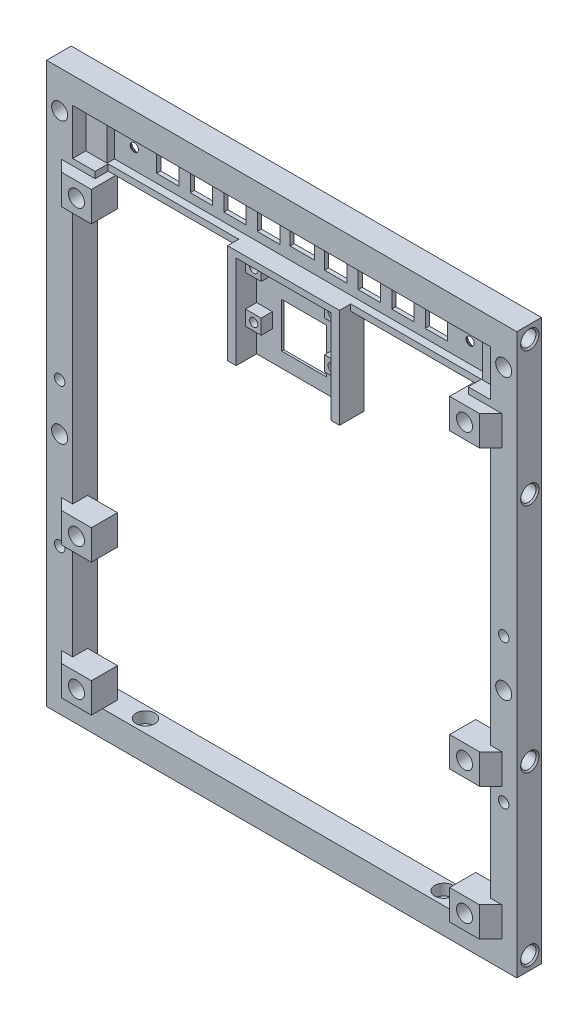
from build123d import *
from build123d.topology import SkipClean

# Parameters (mm, degrees)
SKETCH1_W                = 126
SKETCH1_H                = 150
SKETCH1_W_2              = 112
SKETCH1_H_2              = 136
BOSS_EXTRUDE1_DEPTH      = 7
SKETCH2_R                = 2.05
CUT_EXTRUDE1_DEPTH       = 6
SKETCH3_R                = 1.35
CUT_EXTRUDE2_DEPTH       = 157.419308271
SKETCH4_R                = 2.5
CUT_EXTRUDE3_DEPTH       = 3
SKETCH5_R                = 1.4
CUT_EXTRUDE4_DEPTH       = 99.198777996
SKETCH6_R                = 2.5
CUT_EXTRUDE5_DEPTH       = 3
SKETCH7_R                = 2.15
CUT_EXTRUDE6_DEPTH       = 99.198777996
CUT_EXTRUDE7_DEPTH       = 0.2
SKETCH9_W                = 2.8
SKETCH9_H                = 2.8
CUT_EXTRUDE8_DEPTH       = 0.2
SKETCH10_W               = 6
SKETCH10_H               = 6
BOSS_EXTRUDE2_DEPTH      = 5.5
SKETCH11_R               = 1.65
CUT_EXTRUDE9_DEPTH       = 99.103261923
SKETCH12_W               = 112
SKETCH12_H               = 14
BOSS_EXTRUDE3_DEPTH      = 1.5
SKETCH13_W               = 112
SKETCH13_H               = 14
SKETCH13_W_2             = 100.6
SKETCH13_H_2             = 10.6
BOSS_EXTRUDE4_DEPTH      = 2
SKETCH14_W               = 6
SKETCH14_H               = 6
SKETCH14_W_2             = 6.5
SKETCH14_H_2             = 4
CUT_EXTRUDE10_DEPTH      = 99.103261923
SKETCH15_R               = 1
BOSS_EXTRUDE5_DEPTH      = 2
CHAMFER2_SIZE            = 0.4
CHAMFER3_SIZE            = 0.4
SKETCH16_W               = 6
SKETCH16_H               = 6
BOSS_EXTRUDE7_DEPTH      = 5.5
SKETCH17_R               = 1.65
CUT_EXTRUDE11_DEPTH      = 99.103261923
CUT_EXTRUDE12_DEPTH      = 99.103261923
CUT_EXTRUDE12_DEPTH_BACK = 99.103261923
SKETCH18_R               = 1.1
CHAMFER4_SIZE            = 1.3
SKETCH19_W               = 112
SKETCH19_H               = 122
CUT_EXTRUDE13_DEPTH      = 99.103261923
SKETCH20_W               = 8
SKETCH20_H               = 8
BOSS_EXTRUDE8_DEPTH      = 7
SKETCH21_R               = 2.15
CUT_EXTRUDE14_DEPTH      = 99.198777996
CHAMFER5_SIZE            = 3
SKETCH23_W               = 30
SKETCH23_H               = 25
BOSS_EXTRUDE10_DEPTH     = 3.5
SKETCH24_W               = 25.4
SKETCH24_H               = 25
CUT_EXTRUDE15_DEPTH      = 2.5
SKETCH27_W               = 4.2
SKETCH27_H               = 4.6
SKETCH27_H_2             = 4
BOSS_EXTRUDE11_DEPTH     = 3
SKETCH28_W               = 12
SKETCH28_H               = 12
CUT_EXTRUDE16_DEPTH      = 99.361577865
SKETCH29_R               = 1.1
CUT_EXTRUDE17_DEPTH      = 99.132563403
CHAMFER6_SIZE            = 1.3
CHAMFER7_SIZE            = 0.4
CHAMFER8_SIZE            = 0.4
BOSS_EXTRUDE12_DEPTH     = 3
CHAMFER9_SIZE            = 0.4


with BuildPart() as part:
    # Sketch1 → Boss-Extrude1 (new body)
    with BuildSketch(Plane.XY):
        Rectangle(SKETCH1_W, SKETCH1_H)
        Rectangle(SKETCH1_W_2, SKETCH1_H_2, mode=Mode.SUBTRACT)
    extrude(amount=BOSS_EXTRUDE1_DEPTH)

    # Sketch2 → Cut-Extrude1 (cut)
    with BuildSketch(Plane.ZY.offset(63)):
        with Locations((3.5, -71.5)):
            Circle(SKETCH2_R)
        with Locations((3.5, 71.5)):
            Circle(SKETCH2_R)
        with Locations((3.5, 35.5)):
            Circle(SKETCH2_R)
        with Locations((3.5, -26.5)):
            Circle(SKETCH2_R)
    cut_extrude1 = extrude(amount=-CUT_EXTRUDE1_DEPTH, mode=Mode.SUBTRACT)

    # Mirror1: Cut-Extrude1 across plane
    add(cut_extrude1.mirror(Plane(origin=(0, 0, 0), x_dir=(0, 0, 1), z_dir=(1, 0, 0))), mode=Mode.SUBTRACT)

    # Sketch3 → Cut-Extrude2 (cut, through all)
    with BuildSketch(Plane(origin=(0, -68, 0), x_dir=(1, 0, 0), z_dir=(0, 1, 0))):
        with Locations(Location((40, -3.5, 0), (0, 0, 270))):
            Circle(SKETCH3_R)
        with Locations(Location((-40, -3.5, 0), (0, 0, 270))):
            Circle(SKETCH3_R)
    extrude(amount=-CUT_EXTRUDE2_DEPTH, mode=Mode.SUBTRACT)

    # Sketch4 → Cut-Extrude3 (cut)
    with BuildSketch(Plane(origin=(0, -68, 0), x_dir=(1, 0, 0), z_dir=(0, 1, 0))):
        with Locations(Location((40, -3.5, 0), (0, 0, 270))):
            Circle(SKETCH4_R)
        with Locations(Location((-40, -3.5, 0), (0, 0, 270))):
            Circle(SKETCH4_R)
    extrude(amount=-CUT_EXTRUDE3_DEPTH, mode=Mode.SUBTRACT)

    # Sketch5 → Cut-Extrude4 (cut, through all)
    with BuildSketch(Plane(origin=(0, 0, 0), x_dir=(-1, 0, 0), z_dir=(0, 0, -1))):
        with Locations((-59.5, 2.6)):
            Circle(SKETCH5_R)
        with Locations(Location((59.5, 2.6, 0), (0, 0, 180))):
            Circle(SKETCH5_R)
        with Locations((-59.5, -36)):
            Circle(SKETCH5_R)
        with Locations(Location((59.5, -36, 0), (0, 0, 180))):
            Circle(SKETCH5_R)
    extrude(amount=-CUT_EXTRUDE4_DEPTH, mode=Mode.SUBTRACT)

    # Sketch6 → Cut-Extrude5 (cut)
    with BuildSketch(Plane(origin=(0, 0, 0), x_dir=(-1, 0, 0), z_dir=(0, 0, -1))):
        with Locations((-59.5, 2.6)):
            Circle(SKETCH6_R)
        with Locations((59.5, 2.6)):
            Circle(SKETCH6_R)
        with Locations((-59.5, -36)):
            Circle(SKETCH6_R)
        with Locations((59.5, -36)):
            Circle(SKETCH6_R)
    extrude(amount=-CUT_EXTRUDE5_DEPTH, mode=Mode.SUBTRACT)

    # Sketch7 → Cut-Extrude6 (cut, through all)
    with BuildSketch(Plane(origin=(0, 0, 0), x_dir=(-1, 0, 0), z_dir=(0, 0, -1))):
        with Locations((-59.5, 65)):
            Circle(SKETCH7_R)
        with Locations((-59.5, -10)):
            Circle(SKETCH7_R)
    cut_extrude6 = extrude(amount=-CUT_EXTRUDE6_DEPTH, mode=Mode.SUBTRACT)

    # Mirror2: Cut-Extrude6 across plane
    add(cut_extrude6.mirror(Plane(origin=(0, 0, 0), x_dir=(0, 0, 1), z_dir=(1, 0, 0))), mode=Mode.SUBTRACT)

    # Sketch8 → Cut-Extrude7 (cut)
    with SkipClean():  # the faces are left unmerged after this step: merging them gives an invalid solid
        with BuildSketch(Plane(origin=(0, 0, 3), x_dir=(-1, 0, 0), z_dir=(0, 0, -1))):
            with BuildLine():
                Line((-60.9, 0.528768482), (-60.9, 4.671231518))
                ThreePointArc((-60.9, 4.671231518), (-59.5, 5.1), (-58.1, 4.671231518))
                Line((-58.1, 4.671231518), (-58.1, 0.528768482))
                ThreePointArc((-58.1, 0.528768482), (-59.5, 0.1), (-60.9, 0.528768482))
            make_face()
            with BuildLine():
                Line((-60.9, -38.071231518), (-60.9, -33.928768482))
                ThreePointArc((-60.9, -33.928768482), (-59.5, -33.5), (-58.1, -33.928768482))
                Line((-58.1, -33.928768482), (-58.1, -38.071231518))
                ThreePointArc((-58.1, -38.071231518), (-59.5, -38.5), (-60.9, -38.071231518))
            make_face()
        cut_extrude7 = extrude(amount=-CUT_EXTRUDE7_DEPTH, mode=Mode.SUBTRACT)

    # Sketch9 → Cut-Extrude8 (cut)
    with SkipClean():  # the faces are left unmerged after this step: merging them gives an invalid solid
        with BuildSketch(Plane(origin=(0, 0, 3.2), x_dir=(-1, 0, 0), z_dir=(0, 0, -1))):
            with Locations((-59.5, 2.6)):
                Rectangle(SKETCH9_W, SKETCH9_H)
            with Locations((-59.5, -36)):
                Rectangle(SKETCH9_W, SKETCH9_H)
        cut_extrude8 = extrude(amount=-CUT_EXTRUDE8_DEPTH, mode=Mode.SUBTRACT)

    # Mirror3: Cut-Extrude7, Cut-Extrude8 across plane
    with SkipClean():  # the faces are left unmerged after this step: merging them gives an invalid solid
        add(cut_extrude7.mirror(Plane(origin=(0, 0, 0), x_dir=(0, 0, 1), z_dir=(1, 0, 0))), mode=Mode.SUBTRACT)
        add(cut_extrude8.mirror(Plane(origin=(0, 0, 0), x_dir=(0, 0, 1), z_dir=(1, 0, 0))), mode=Mode.SUBTRACT)

    # Sketch10 → Boss-Extrude2 (add)
    with SkipClean():  # the faces are left unmerged after this step: merging them gives an invalid solid
        with BuildSketch(Plane.XY.offset(7)):
            with Locations((53, -65)):
                Rectangle(SKETCH10_W, SKETCH10_H)
            with Locations((53, -35.5)):
                Rectangle(SKETCH10_W, SKETCH10_H)
        boss_extrude2 = extrude(amount=-BOSS_EXTRUDE2_DEPTH)

    # Sketch11 → Cut-Extrude9 (cut, through all)
    with SkipClean():  # the faces are left unmerged after this step: merging them gives an invalid solid
        with BuildSketch(Plane(origin=(0, 0, 1.5), x_dir=(-1, 0, 0), z_dir=(0, 0, -1))):
            with Locations((-53, -35.5)):
                Circle(SKETCH11_R)
            with Locations((-53, -65)):
                Circle(SKETCH11_R)
        cut_extrude9 = extrude(amount=-CUT_EXTRUDE9_DEPTH, mode=Mode.SUBTRACT)

    # Mirror4: Boss-Extrude2, Cut-Extrude9 across plane
    with SkipClean():  # the faces are left unmerged after this step: merging them gives an invalid solid
        add(boss_extrude2.mirror(Plane(origin=(0, 0, 0), x_dir=(0, 0, 1), z_dir=(1, 0, 0))))
        add(cut_extrude9.mirror(Plane(origin=(0, 0, 0), x_dir=(0, 0, 1), z_dir=(1, 0, 0))), mode=Mode.SUBTRACT)

    # Sketch12 → Boss-Extrude3 (add)
    with SkipClean():  # the faces are left unmerged after this step: merging them gives an invalid solid
        with BuildSketch(Plane(origin=(0, 0, 0), x_dir=(-1, 0, 0), z_dir=(0, 0, -1))):
            with Locations((0, 61)):
                Rectangle(SKETCH12_W, SKETCH12_H)
        extrude(amount=-BOSS_EXTRUDE3_DEPTH)

    # Sketch13 → Boss-Extrude4 (add)
    with SkipClean():  # the faces are left unmerged after this step: merging them gives an invalid solid
        with BuildSketch(Plane.XY.offset(1.5)):
            with Locations((0, 61)):
                Rectangle(SKETCH13_W, SKETCH13_H)
            with Locations((0, 61)):
                Rectangle(SKETCH13_W_2, SKETCH13_H_2, mode=Mode.SUBTRACT)
        extrude(amount=BOSS_EXTRUDE4_DEPTH)

    # Sketch14 → Cut-Extrude10 (cut, through all)
    with SkipClean():  # the faces are left unmerged after this step: merging them gives an invalid solid
        with BuildSketch(Plane.XY.offset(1.5)):
            with Locations((-36, 61)):
                Rectangle(SKETCH14_W, SKETCH14_H)
            with Locations((0, 61)):
                Rectangle(SKETCH14_W_2, SKETCH14_H_2)
            with Locations((9, 61)):
                Rectangle(SKETCH14_W, SKETCH14_H)
            with Locations((18, 61)):
                Rectangle(SKETCH14_W, SKETCH14_H)
            with Locations((27, 61)):
                Rectangle(SKETCH14_W, SKETCH14_H)
            with Locations((36, 61)):
                Rectangle(SKETCH14_W, SKETCH14_H)
            with Locations((-27, 61)):
                Rectangle(SKETCH14_W, SKETCH14_H)
            with Locations((-18, 61)):
                Rectangle(SKETCH14_W, SKETCH14_H)
            with Locations((-9, 61)):
                Rectangle(SKETCH14_W, SKETCH14_H)
        extrude(amount=-CUT_EXTRUDE10_DEPTH, mode=Mode.SUBTRACT)

    # Sketch15 → Boss-Extrude5 (add)
    with SkipClean():  # the faces are left unmerged after this step: merging them gives an invalid solid
        with BuildSketch(Plane.XY.offset(1.5)):
            with Locations(Location((-45, 61, 0), (0, 0, 180))):
                Circle(SKETCH15_R)
            with Locations(Location((45, 61, 0), (0, 0, 180))):
                Circle(SKETCH15_R)
        extrude(amount=BOSS_EXTRUDE5_DEPTH)

    # Chamfer1: read off the stored shape, not the designer's step
    # Chamfer1: loft between two sections, ruled curve by curve
    with SkipClean():  # the faces are left unmerged after this step: merging them gives an invalid solid
        chamfer1_from = [
            Edge.make_line((-56, 54, 0.4), (-56, -68, 0.4)),
            Edge.make_line((-56, -68, 0.4), (56, -68, 0.4)),
            Edge.make_line((56, -68, 0.4), (56, 54, 0.4)),
            Edge.make_line((56, 54, 0.4), (-56, 54, 0.4)),
        ]
        chamfer1_to = [
            Edge.make_line((-56.4, 54, 0), (-56.4, -68.4, 0)),
            Edge.make_line((-56.4, -68.4, 0), (56.4, -68.4, 0)),
            Edge.make_line((56.4, -68.4, 0), (56.4, 54, 0)),
            Edge.make_line((56.4, 54, 0), (-56.4, 54, 0)),
        ]
        chamfer1 = Solid(Shell([*[Face.make_surface_from_curves(chamfer1_from[k], chamfer1_to[k]) for k in range(4)], Face(Wire(chamfer1_from)), Face(Wire(chamfer1_to))]))
        add(chamfer1, mode=Mode.SUBTRACT)

    # Chamfer2
    chamfer2_edges = [part.edges().sort_by_distance(p)[0] for p in [
        (0, -75, 0),
        (-63, 0, 0),
        (0, 75, 0),
        (63, 0, 0),
    ]]
    chamfer(chamfer2_edges, length=CHAMFER2_SIZE)

    # Chamfer3
    chamfer3_edges = [part.edges().sort_by_distance(p)[0] for p in [
        (-6, 61, 0),
        (-9, 58, 0),
        (-12, 61, 0),
        (-9, 64, 0),
        (-15, 61, 0),
        (-18, 58, 0),
        (-21, 61, 0),
        (-18, 64, 0),
        (-24, 61, 0),
        (-27, 58, 0),
        (-30, 61, 0),
        (-27, 64, 0),
        (-33, 61, 0),
        (-36, 58, 0),
        (-39, 61, 0),
        (-36, 64, 0),
        (39, 61, 0),
        (36, 58, 0),
        (33, 61, 0),
        (36, 64, 0),
        (30, 61, 0),
        (27, 58, 0),
        (24, 61, 0),
        (27, 64, 0),
        (21, 61, 0),
        (18, 58, 0),
        (15, 61, 0),
        (18, 64, 0),
        (12, 61, 0),
        (9, 58, 0),
        (6, 61, 0),
        (9, 64, 0),
        (3.25, 61, 0),
        (0, 59, 0),
        (-3.25, 61, 0),
        (0, 63, 0),
    ]]
    chamfer(chamfer3_edges, length=CHAMFER3_SIZE)

    # Sketch16 → Boss-Extrude7 (add)
    with SkipClean():  # the faces are left unmerged after this step: merging them gives an invalid solid
        with BuildSketch(Plane.XY.offset(7)):
            Polygon((-50, 54), (-50, 55.7), (-56, 55.7), (-56, 54), (-56, 48), (-50, 48), align=None)
            with Locations((-53, -29.5)):
                Rectangle(SKETCH16_W, SKETCH16_H)
            with Locations((53, -29.5)):
                Rectangle(SKETCH16_W, SKETCH16_H)
            Polygon((56, 54), (56, 48), (50, 48), (50, 54), (50, 55.7), (56, 55.7), align=None)
        extrude(amount=-BOSS_EXTRUDE7_DEPTH)

    # Sketch17 → Cut-Extrude11 (cut, through all)
    with SkipClean():  # the faces are left unmerged after this step: merging them gives an invalid solid
        with BuildSketch(Plane(origin=(0, 0, 1.5), x_dir=(-1, 0, 0), z_dir=(0, 0, -1))):
            with Locations((-53, -29.5)):
                Circle(SKETCH17_R)
            with Locations((53, -29.5)):
                Circle(SKETCH17_R)
            with Locations((53, 51)):
                Circle(SKETCH17_R)
            with Locations((-53, 51)):
                Circle(SKETCH17_R)
        extrude(amount=-CUT_EXTRUDE11_DEPTH, mode=Mode.SUBTRACT)

    # Sketch18 → Cut-Extrude12 (cut, two sides: drawn at the far end of the back side and taken through both)
    with SkipClean():  # the faces are left unmerged after this step: merging them gives an invalid solid
        with BuildSketch(Plane.XY.offset(1.5).offset(-CUT_EXTRUDE12_DEPTH_BACK)):
            with Locations((-45, 61)):
                Circle(SKETCH18_R)
            with Locations((45, 61)):
                Circle(SKETCH18_R)
        extrude(amount=CUT_EXTRUDE12_DEPTH + CUT_EXTRUDE12_DEPTH_BACK, mode=Mode.SUBTRACT)

    # Chamfer4
    chamfer4_edges = [part.edges().sort_by_distance(p)[0] for p in [
        (-46.1, 61, 0),
        (43.9, 61, 0),
    ]]
    chamfer(chamfer4_edges, length=CHAMFER4_SIZE)

    # Sketch19 → Cut-Extrude13 (cut, through all)
    with SkipClean():  # the faces are left unmerged after this step: merging them gives an invalid solid
        with BuildSketch(Plane(origin=(0, 0, 1.5), x_dir=(-1, 0, 0), z_dir=(0, 0, -1))):
            with Locations((0, -7)):
                Rectangle(SKETCH19_W, SKETCH19_H)
        extrude(amount=-CUT_EXTRUDE13_DEPTH, mode=Mode.SUBTRACT)

    # Sketch20 → Boss-Extrude8 (add)
    with SkipClean():  # the faces are left unmerged after this step: merging them gives an invalid solid
        with BuildSketch(Plane.XY.offset(3)):
            with Locations((52, -64)):
                Rectangle(SKETCH20_W, SKETCH20_H)
            with Locations((52, 50)):
                Rectangle(SKETCH20_W, SKETCH20_H)
            with Locations((52, -28.5)):
                Rectangle(SKETCH20_W, SKETCH20_H)
        boss_extrude8 = extrude(amount=BOSS_EXTRUDE8_DEPTH)

    # Sketch21 → Cut-Extrude14 (cut, through all)
    with SkipClean():  # the faces are left unmerged after this step: merging them gives an invalid solid
        with BuildSketch(Plane(origin=(0, 0, 3), x_dir=(-1, 0, 0), z_dir=(0, 0, -1))):
            with Locations((-52, 50)):
                Circle(SKETCH21_R)
            with Locations((-52, -64)):
                Circle(SKETCH21_R)
            with Locations((-52, -28.5)):
                Circle(SKETCH21_R)
        cut_extrude14 = extrude(amount=-CUT_EXTRUDE14_DEPTH, mode=Mode.SUBTRACT)

    # Mirror5: Boss-Extrude8, Cut-Extrude14 across plane
    with SkipClean():  # the faces are left unmerged after this step: merging them gives an invalid solid
        add(boss_extrude8.mirror(Plane(origin=(0, 0, 0), x_dir=(0, 0, 1), z_dir=(1, 0, 0))))
        add(cut_extrude14.mirror(Plane(origin=(0, 0, 0), x_dir=(0, 0, 1), z_dir=(1, 0, 0))), mode=Mode.SUBTRACT)

    # Chamfer5
    # the kernel refuses this chamfer: 3 mm, written as the material it adds along each edge
    with BuildSketch(Plane(origin=(-56, -62, 7), x_dir=(-1, 0, 0), z_dir=(0, -1, 0)), Plane(origin=(56, -68, 7), x_dir=(1, 0, 0), z_dir=(0, 1, 0)), Plane(origin=(-56, -26.5, 7), x_dir=(-1, 0, 0), z_dir=(0, -1, 0)), Plane(origin=(56, -32.5, 7), x_dir=(1, 0, 0), z_dir=(0, 1, 0))) as chamfer5_piece_1:
        Polygon((CHAMFER5_SIZE, 0), (0, -CHAMFER5_SIZE), (0, 0), align=None)
    extrude(amount=6)
    with BuildSketch(Plane(origin=(56, 54, 7), x_dir=(1, 0, 0), z_dir=(0, -1, 0)), Plane(origin=(-56, 48, 7), x_dir=(-1, 0, 0), z_dir=(0, 1, 0))) as chamfer5_piece_2:
        Polygon((CHAMFER5_SIZE, 0), (0, CHAMFER5_SIZE), (0, 0), align=None)
    extrude(amount=6)
    with BuildSketch(Plane(origin=(56, -26.5, 7), x_dir=(1, 0, 0), z_dir=(0, 1, 0)), Plane(origin=(-56, -24.5, 7), x_dir=(-1, 0, 0), z_dir=(0, -1, 0)), Plane(origin=(-56, 48, 7), x_dir=(-1, 0, 0), z_dir=(0, -1, 0)), Plane(origin=(56, 46, 7), x_dir=(1, 0, 0), z_dir=(0, 1, 0)), Plane(origin=(56, -62, 7), x_dir=(1, 0, 0), z_dir=(0, 1, 0)), Plane(origin=(-56, -60, 7), x_dir=(-1, 0, 0), z_dir=(0, -1, 0))) as chamfer5_piece_3:
        Polygon((CHAMFER5_SIZE, 0), (0, -CHAMFER5_SIZE), (0, 0), align=None)
    extrude(amount=2)

    # Sketch23 → Boss-Extrude10 (add)
    with BuildSketch(Plane(origin=(0, 0, 0), x_dir=(-1, 0, 0), z_dir=(0, 0, -1))):
        with Locations((0, 41.5)):
            Rectangle(SKETCH23_W, SKETCH23_H)
    extrude(amount=-BOSS_EXTRUDE10_DEPTH)

    # Sketch24 → Cut-Extrude15 (cut)
    with BuildSketch(Plane.XY.offset(3.5)):
        with Locations((0, 41.5)):
            Rectangle(SKETCH24_W, SKETCH24_H)
    extrude(amount=-CUT_EXTRUDE15_DEPTH, mode=Mode.SUBTRACT)

    # Sketch27 → Boss-Extrude11 (add)
    with BuildSketch(Plane.XY.offset(1)):
        with Locations((-10.6, 51.7)):
            Rectangle(SKETCH27_W, SKETCH27_H)
        with Locations((-10.6, 38.9)):
            Rectangle(SKETCH27_W, SKETCH27_H_2)
        with Locations((10.6, 38.9)):
            Rectangle(SKETCH27_W, SKETCH27_H_2)
        with Locations((10.6, 51.7)):
            Rectangle(SKETCH27_W, SKETCH27_H)
    extrude(amount=BOSS_EXTRUDE11_DEPTH)

    # Sketch28 → Cut-Extrude16 (cut, through all)
    with BuildSketch(Plane.XY.offset(1)):
        with Locations((0, 39)):
            Rectangle(SKETCH28_W, SKETCH28_H)
    extrude(amount=-CUT_EXTRUDE16_DEPTH, mode=Mode.SUBTRACT)

    # Sketch29 → Cut-Extrude17 (cut, through all)
    with BuildSketch(Plane.XY.offset(4)):
        with Locations((-10.5, 38.9)):
            Circle(SKETCH29_R)
        with Locations((-10.5, 51.4)):
            Circle(SKETCH29_R)
        with Locations((10.5, 51.4)):
            Circle(SKETCH29_R)
        with Locations((10.5, 38.9)):
            Circle(SKETCH29_R)
    extrude(amount=-CUT_EXTRUDE17_DEPTH, mode=Mode.SUBTRACT)

    # Chamfer6
    chamfer6_edges = [part.edges().sort_by_distance(p)[0] for p in [
        (9.4, 38.9, 0),
        (9.4, 51.4, 0),
        (-11.6, 51.4, 0),
        (-11.6, 38.9, 0),
    ]]
    chamfer(chamfer6_edges, length=CHAMFER6_SIZE)

    # Chamfer7
    chamfer7_edges = [part.edges().sort_by_distance(p)[0] for p in [
        (6, 39, 0),
        (0, 33, 0),
        (-6, 39, 0),
        (0, 45, 0),
    ]]
    chamfer(chamfer7_edges, length=CHAMFER7_SIZE)

    # Chamfer8
    chamfer8_edges = [part.edges().sort_by_distance(p)[0] for p in [
        (-35.7, 54, 0),
        (35.7, 54, 0),
    ]]
    chamfer(chamfer8_edges, length=CHAMFER8_SIZE)

    # Sketch30 → Boss-Extrude12 (add)
    with BuildSketch(Plane.XY.offset(3.5)):
        Polygon((-12.7, 29), (-12.7, 54), (12.7, 54), (12.7, 29), (15, 29), (15, 55.7), (-15, 55.7), (-15, 29), align=None)
    extrude(amount=BOSS_EXTRUDE12_DEPTH)

    # Chamfer9
    chamfer9_edges = [part.edges().sort_by_distance(p)[0] for p in [
        (54.15, 50, 3),
        (54.15, -64, 3),
        (54.15, -28.5, 3),
        (-54.15, 50, 3),
        (-54.15, -64, 3),
        (-54.15, -28.5, 3),
        (61.65, -10, 0),
        (61.65, 65, 0),
        (-61.65, -10, 0),
        (-61.65, 65, 0),
        (-63, -71.5, 1.45),
        (-63, 35.5, 1.45),
        (-63, 71.5, 1.45),
        (-63, -26.5, 1.45),
        (63, -71.5, 1.45),
        (63, 35.5, 1.45),
        (63, 71.5, 1.45),
        (63, -26.5, 1.45),
    ]]
    chamfer(chamfer9_edges, length=CHAMFER9_SIZE)


solid = part.part
